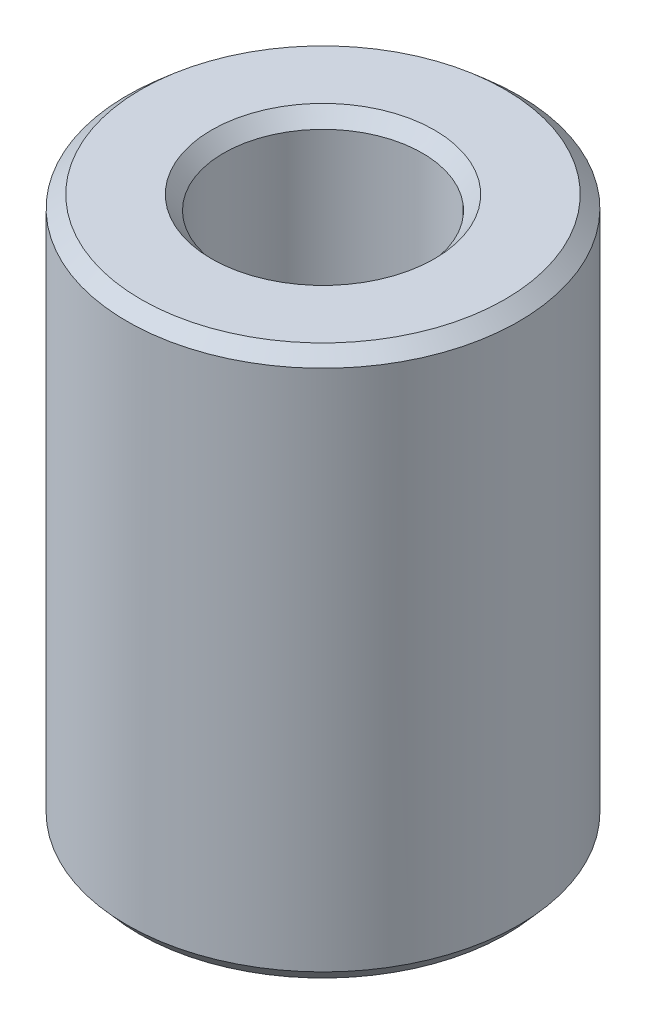
from build123d import *
from OCP.BRepFilletAPI import BRepFilletAPI_MakeChamfer

# Parameters (mm, degrees)
SKETCH1_R           = 45
BOSS_EXTRUDE1_DEPTH = 126.122248726
SKETCH2_R           = 22.842571611
CUT_EXTRUDE1_DEPTH  = 142.268615141
CHAMFER1_SIZE       = 2.789362572
CHAMFER1_SIZE2      = 3.19014125


with BuildPart() as part:
    # Sketch1 → Boss-Extrude1 (new body)
    with BuildSketch(Plane(origin=(0, 0, 0), x_dir=(1, 0, 0), z_dir=(0, 1, 0))):
        Circle(SKETCH1_R)
    extrude(amount=BOSS_EXTRUDE1_DEPTH)

    # Sketch2 → Cut-Extrude1 (cut, through all)
    with BuildSketch(Plane(origin=(0, 0, 0), x_dir=(1, 0, 0), z_dir=(0, 1, 0))):
        Circle(SKETCH2_R)
    extrude(amount=CUT_EXTRUDE1_DEPTH, mode=Mode.SUBTRACT)

    # Chamfer1: one chamfer whose edges measure the first distance from different faces: ONE call of the kernel's chamfer builder (chamfer() names one face for all edges)
    chamfer1_edges_1 = [part.edges().sort_by_distance(p)[0] for p in [
        (-22.842571611, 126.122248726, 0),
    ]]
    chamfer1_side_1 = [part.faces().sort_by_distance(p)[0] for p in [
        (-43.727207794, 126.122248726, 0),
    ]]
    chamfer1_edges_2 = [part.edges().sort_by_distance(p)[0] for p in [
        (-22.842571611, 0, 0),
    ]]
    chamfer1_side_2 = [part.faces().sort_by_distance(p)[0] for p in [
        (-22.842571611, 63.061124363, 0),
    ]]
    chamfer1_edges_3 = [part.edges().sort_by_distance(p)[0] for p in [
        (-45, 0, 0),
    ]]
    chamfer1_side_3 = [part.faces().sort_by_distance(p)[0] for p in [
        (-43.727207794, 0, 0),
    ]]
    chamfer1_edges_4 = [part.edges().sort_by_distance(p)[0] for p in [
        (-45, 126.122248726, 0),
    ]]
    chamfer1_side_4 = [part.faces().sort_by_distance(p)[0] for p in [
        (-45, 63.061124363, 0),
    ]]
    chamfer1 = BRepFilletAPI_MakeChamfer(part.part.solid().wrapped)
    for e in chamfer1_edges_1:
        chamfer1.Add(CHAMFER1_SIZE, CHAMFER1_SIZE2, e.wrapped, chamfer1_side_1[0].wrapped)  # the first distance lies on this face
    for e in chamfer1_edges_2:
        chamfer1.Add(CHAMFER1_SIZE, CHAMFER1_SIZE2, e.wrapped, chamfer1_side_2[0].wrapped)  # the first distance lies on this face
    for e in chamfer1_edges_3:
        chamfer1.Add(CHAMFER1_SIZE, CHAMFER1_SIZE2, e.wrapped, chamfer1_side_3[0].wrapped)  # the first distance lies on this face
    for e in chamfer1_edges_4:
        chamfer1.Add(CHAMFER1_SIZE, CHAMFER1_SIZE2, e.wrapped, chamfer1_side_4[0].wrapped)  # the first distance lies on this face
    add(Compound.cast(chamfer1.Shape()), mode=Mode.REPLACE)


solid = part.part
